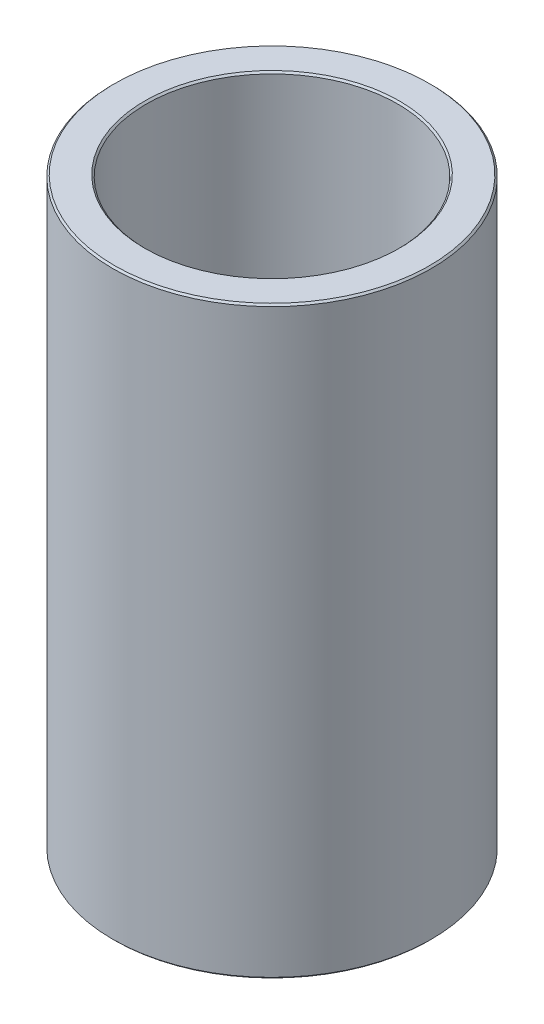
from build123d import *

# Parameters (mm, degrees)
SKETCH1_R           = 50
BOSS_EXTRUDE1_DEPTH = 183.394595458
SKETCH2_R           = 39.47831382
CUT_EXTRUDE1_DEPTH  = 197.55426132
CHAMFER1_SIZE       = 0.541928897


with BuildPart() as part:
    # Sketch1 → Boss-Extrude1 (new body)
    with BuildSketch(Plane(origin=(0, 0, 0), x_dir=(1, 0, 0), z_dir=(0, 1, 0))):
        Circle(SKETCH1_R)
    extrude(amount=BOSS_EXTRUDE1_DEPTH)

    # Sketch2 → Cut-Extrude1 (cut, through all)
    with BuildSketch(Plane(origin=(0, 0, 0), x_dir=(1, 0, 0), z_dir=(0, 1, 0))):
        Circle(SKETCH2_R)
    extrude(amount=CUT_EXTRUDE1_DEPTH, mode=Mode.SUBTRACT)

    # Chamfer1
    chamfer1_edges = [part.edges().sort_by_distance(p)[0] for p in [
        (-39.47831382, 183.394595458, 0),
        (-39.47831382, 0, 0),
        (-50, 0, 0),
        (-50, 183.394595458, 0),
    ]]
    chamfer(chamfer1_edges, length=CHAMFER1_SIZE)


solid = part.part
